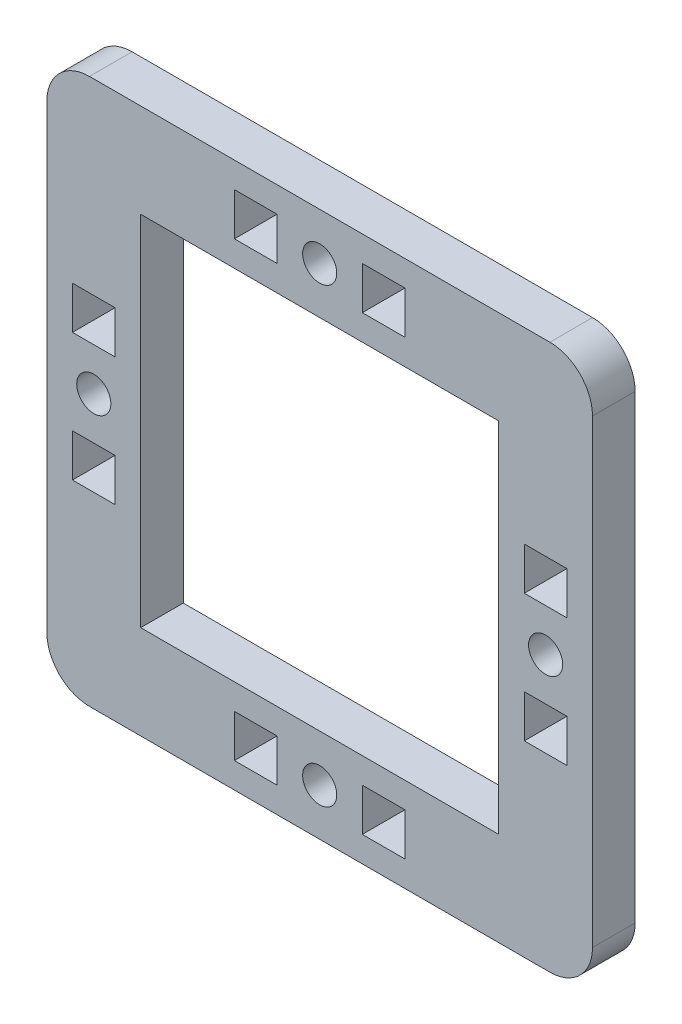
from build123d import *

# Parameters (mm, degrees)
ESQUISSE1_W        = 64
ESQUISSE1_H        = 64
ESQUISSE1_R        = 2
ESQUISSE1_W_2      = 42
ESQUISSE1_H_2      = 42
ESQUISSE1_W_3      = 5
ESQUISSE1_H_3      = 5
BOSS_EXTRU_1_DEPTH = 5
CONG_1_R           = 5


with BuildPart() as part:
    # Esquisse1 → Boss.-Extru.1 (new body)
    with BuildSketch(Plane.XY):
        Rectangle(ESQUISSE1_W, ESQUISSE1_H)
        with Locations((26.5, 0)):
            Circle(ESQUISSE1_R, mode=Mode.SUBTRACT)
        with Locations((-26.5, 0)):
            Circle(ESQUISSE1_R, mode=Mode.SUBTRACT)
        with Locations((0, 26.5)):
            Circle(ESQUISSE1_R, mode=Mode.SUBTRACT)
        with Locations((0, -26.5)):
            Circle(ESQUISSE1_R, mode=Mode.SUBTRACT)
        Rectangle(ESQUISSE1_W_2, ESQUISSE1_H_2, mode=Mode.SUBTRACT)
        with Locations((26.5, 7.5)):
            Rectangle(ESQUISSE1_W_3, ESQUISSE1_H_3, mode=Mode.SUBTRACT)
        with Locations((26.5, -7.5)):
            Rectangle(ESQUISSE1_W_3, ESQUISSE1_H_3, mode=Mode.SUBTRACT)
        with Locations((-26.5, 7.5)):
            Rectangle(ESQUISSE1_W_3, ESQUISSE1_H_3, mode=Mode.SUBTRACT)
        with Locations((-26.5, -7.5)):
            Rectangle(ESQUISSE1_W_3, ESQUISSE1_H_3, mode=Mode.SUBTRACT)
        with Locations((7.5, 26.5)):
            Rectangle(ESQUISSE1_W_3, ESQUISSE1_H_3, mode=Mode.SUBTRACT)
        with Locations((-7.5, 26.5)):
            Rectangle(ESQUISSE1_W_3, ESQUISSE1_H_3, mode=Mode.SUBTRACT)
        with Locations((7.5, -26.5)):
            Rectangle(ESQUISSE1_W_3, ESQUISSE1_H_3, mode=Mode.SUBTRACT)
        with Locations((-7.5, -26.5)):
            Rectangle(ESQUISSE1_W_3, ESQUISSE1_H_3, mode=Mode.SUBTRACT)
    extrude(amount=BOSS_EXTRU_1_DEPTH)

    # Congé1
    cong_1_edges = [part.edges().sort_by_distance(p)[0] for p in [
        (32, -32, 2.5),
        (-32, -32, 2.5),
        (-32, 32, 2.5),
        (32, 32, 2.5),
    ]]
    fillet(cong_1_edges, radius=CONG_1_R)


solid = part.part
